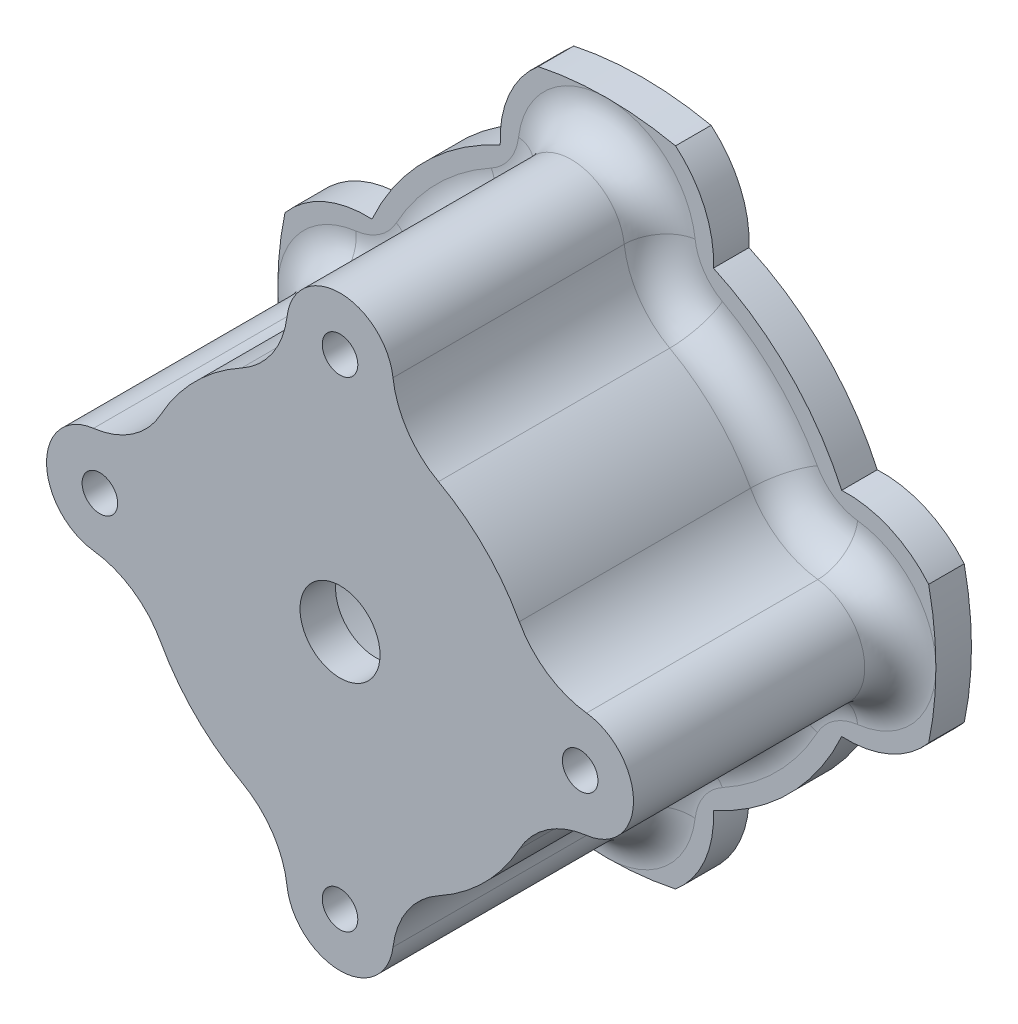
from build123d import *

# Parameters (mm, degrees)
SKETCH1_R               = 1
BOSS_EXTRUDE1_DEPTH     = 2
SKETCH2_R               = 9.5
SKETCH2_R_2             = 1
SKETCH2_R_3             = 2.25
BOSS_EXTRUDE2_DEPTH     = 15
CUT_EXTRUDE1_DEPTH      = 13
CUT_EXTRUDE1_DEPTH_BACK = 31.1579177
SKETCH2_3_R             = 9.5
SKETCH2_3_R_2           = 2.25
CHAMFER1_SIZE           = 2
FILLET1_R               = 2


with BuildPart() as part:
    # Sketch1 → Boss-Extrude1 (new body)
    with BuildSketch(Plane.XY.offset(3)):
        with BuildLine():
            ThreePointArc((-3.861100009, -18.092592593), (0, -18.5), (3.861100009, -18.092592593))
            ThreePointArc((3.861100009, -18.092592593), (5.499959243, -15.898009243), (5.992679576, -13.203703704))
            ThreePointArc((5.992679576, -13.203703704), (10.253048327, -10.253048327), (13.203703704, -5.992679576))
            ThreePointArc((13.203703704, -5.992679576), (15.898009243, -5.499959243), (18.092592593, -3.861100009))
            ThreePointArc((18.092592593, -3.861100009), (18.5, 0), (18.092592593, 3.861100009))
            ThreePointArc((18.092592593, 3.861100009), (15.898009243, 5.499959243), (13.203703704, 5.992679576))
            ThreePointArc((13.203703704, 5.992679576), (10.253048327, 10.253048327), (5.992679576, 13.203703704))
            ThreePointArc((5.992679576, 13.203703704), (5.499959243, 15.898009243), (3.861100009, 18.092592593))
            ThreePointArc((3.861100009, 18.092592593), (0, 18.5), (-3.861100009, 18.092592593))
            ThreePointArc((-3.861100009, 18.092592593), (-5.499959243, 15.898009243), (-5.992679576, 13.203703704))
            ThreePointArc((-5.992679576, 13.203703704), (-10.253048327, 10.253048327), (-13.203703704, 5.992679576))
            ThreePointArc((-13.203703704, 5.992679576), (-15.898009243, 5.499959243), (-18.092592593, 3.861100009))
            ThreePointArc((-18.092592593, 3.861100009), (-18.5, 0), (-18.092592593, -3.861100009))
            ThreePointArc((-18.092592593, -3.861100009), (-15.898009243, -5.499959243), (-13.203703704, -5.992679576))
            ThreePointArc((-13.203703704, -5.992679576), (-10.253048327, -10.253048327), (-5.992679576, -13.203703704))
            ThreePointArc((-5.992679576, -13.203703704), (-5.499959243, -15.898009243), (-3.861100009, -18.092592593))
        make_face()
        with Locations((13.5, 0)):
            Circle(SKETCH1_R, mode=Mode.SUBTRACT)
        with Locations((0, 13.5)):
            Circle(SKETCH1_R, mode=Mode.SUBTRACT)
        with Locations((-13.5, 0)):
            Circle(SKETCH1_R, mode=Mode.SUBTRACT)
        with Locations((0, -13.5)):
            Circle(SKETCH1_R, mode=Mode.SUBTRACT)
    extrude(amount=BOSS_EXTRUDE1_DEPTH)

    # Sketch2 → Boss-Extrude2 (add)
    # profile 1 of 2: a face of its own
    with BuildSketch(Plane.XY.offset(5)):
        with BuildLine():
            ThreePointArc((2.978187161, 13.861111111), (3.800103213, 11.661877619), (5.535216541, 10.080246914))
            ThreePointArc((5.535216541, 10.080246914), (8.131727984, 8.131727984), (10.080246914, 5.535216541))
            ThreePointArc((10.080246914, 5.535216541), (11.661877619, 3.800103213), (13.861111111, 2.978187161))
            ThreePointArc((13.861111111, 2.978187161), (16.5, 0), (13.861111111, -2.978187161))
            ThreePointArc((13.861111111, -2.978187161), (11.661877619, -3.800103213), (10.080246914, -5.535216541))
            ThreePointArc((10.080246914, -5.535216541), (8.131727984, -8.131727984), (5.535216541, -10.080246914))
            ThreePointArc((5.535216541, -10.080246914), (3.800103213, -11.661877619), (2.978187161, -13.861111111))
            ThreePointArc((2.978187161, -13.861111111), (0, -16.5), (-2.978187161, -13.861111111))
            ThreePointArc((-2.978187161, -13.861111111), (-3.800103213, -11.661877619), (-5.535216541, -10.080246914))
            ThreePointArc((-5.535216541, -10.080246914), (-8.131727984, -8.131727984), (-10.080246914, -5.535216541))
            ThreePointArc((-10.080246914, -5.535216541), (-11.661877619, -3.800103213), (-13.861111111, -2.978187161))
            ThreePointArc((-13.861111111, -2.978187161), (-16.5, 0), (-13.861111111, 2.978187161))
            ThreePointArc((-13.861111111, 2.978187161), (-11.661877619, 3.800103213), (-10.080246914, 5.535216541))
            ThreePointArc((-10.080246914, 5.535216541), (-8.131727984, 8.131727984), (-5.535216541, 10.080246914))
            ThreePointArc((-5.535216541, 10.080246914), (-3.800103213, 11.661877619), (-2.978187161, 13.861111111))
            ThreePointArc((-2.978187161, 13.861111111), (0, 16.5), (2.978187161, 13.861111111))
        make_face()
        Circle(SKETCH2_R, mode=Mode.SUBTRACT)
        with Locations((-13.5, 0)):
            Circle(SKETCH2_R_2, mode=Mode.SUBTRACT)
        with Locations((13.5, 0)):
            Circle(SKETCH2_R_2, mode=Mode.SUBTRACT)
        with Locations((0, 13.5)):
            Circle(SKETCH2_R_2, mode=Mode.SUBTRACT)
        with Locations((0, -13.5)):
            Circle(SKETCH2_R_2, mode=Mode.SUBTRACT)
    # profile 2 of 2: a face of its own
    with BuildSketch(Plane.XY.offset(5)):
        Circle(SKETCH2_R)
        Circle(SKETCH2_R_3, mode=Mode.SUBTRACT)
    extrude(amount=BOSS_EXTRUDE2_DEPTH)

    # Sketch2<3> → Cut-Extrude1 (cut, two sides: drawn at the far end of the back side and taken through both)
    # profile 1 of 2: a face of its own
    with BuildSketch(Plane.XY.offset(5).offset(-CUT_EXTRUDE1_DEPTH_BACK)):
        Circle(SKETCH2_3_R)
        Circle(SKETCH2_3_R_2, mode=Mode.SUBTRACT)
    # profile 2 of 2: a face of its own
    with BuildSketch(Plane.XY.offset(5).offset(-CUT_EXTRUDE1_DEPTH_BACK)):
        Circle(SKETCH2_3_R_2)
    extrude(amount=CUT_EXTRUDE1_DEPTH + CUT_EXTRUDE1_DEPTH_BACK, mode=Mode.SUBTRACT)

    # Chamfer1
    chamfer1_edges = [part.edges().sort_by_distance(p)[0] for p in [
        (-9.5, 0, 3),
    ]]
    chamfer(chamfer1_edges, length=CHAMFER1_SIZE - 0.0001)  # a hair under: the kernel refuses the full size

    # Fillet1
    fillet1_edges = [part.edges().sort_by_distance(p)[0] for p in [
        (-16.5, 0, 5),
        (-11.661877619, -3.800103213, 5),
        (-8.131727984, -8.131727984, 5),
        (0, -16.5, 5),
        (3.800103213, -11.661877619, 5),
        (8.131727984, -8.131727984, 5),
        (16.5, 0, 5),
        (11.661877619, 3.800103213, 5),
        (8.131727984, 8.131727984, 5),
        (3.800103213, 11.661877619, 5),
        (11.661877619, -3.800103213, 5),
        (-3.800103213, -11.661877619, 5),
        (-11.661877619, 3.800103213, 5),
        (0, 16.5, 5),
        (-3.800103213, 11.661877619, 5),
        (-8.131727984, 8.131727984, 5),
    ]]
    fillet(fillet1_edges, radius=FILLET1_R - 0.0001)  # a hair under: the kernel refuses the full size


solid = part.part
